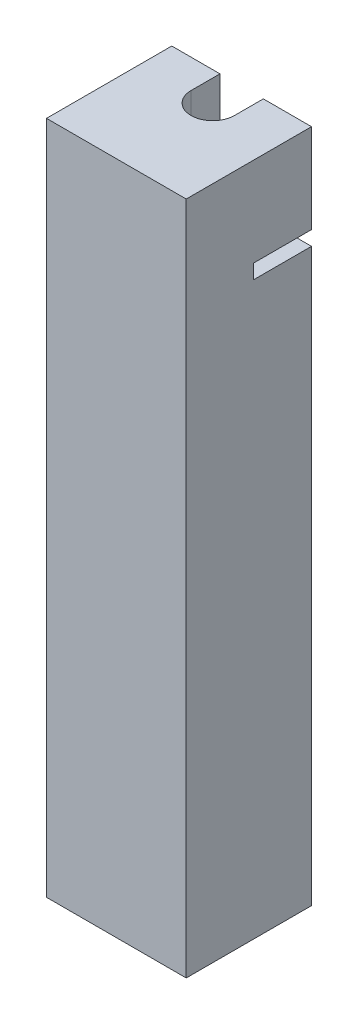
from build123d import *
from build123d.topology import SkipClean

# Parameters (mm, degrees)
BOSS_EXTRUDE1_DEPTH = 35
SKETCH2_W           = 14.5
SKETCH2_H           = 1.5
CUT_EXTRUDE1_DEPTH  = 6
BOSS_EXTRUDE2_REACH = 40.034
SKETCH2_3_W         = 14.5
SKETCH2_3_H         = 9.25
BOSS_EXTRUDE3_START = 3
BOSS_EXTRUDE3_DEPTH = 3


with BuildPart() as part:
    # Sketch1 → Boss-Extrude1 (new, symmetric)
    with BuildSketch(Plane(origin=(0, 0, 0), x_dir=(1, 0, 0), z_dir=(0, 1, 0))):
        with BuildLine():
            Line((-7.25, 3), (-2.25, 3))
            Line((-2.25, 3), (-2.25, 0))
            ThreePointArc((-2.25, 0), (0, -2.25), (2.25, 0))
            Line((2.25, 0), (2.25, 3))
            Line((2.25, 3), (7.25, 3))
            Line((7.25, 3), (7.25, -10))
            Line((7.25, -10), (-7.25, -10))
            Line((-7.25, -10), (-7.25, 3))
        make_face()
    extrude(amount=BOSS_EXTRUDE1_DEPTH, both=True)

    # Sketch2 → Cut-Extrude1 (cut)
    with BuildSketch(Plane(origin=(0, 0, -3), x_dir=(-1, 0, 0), z_dir=(0, 0, -1))):
        with Locations((0, 25)):
            Rectangle(SKETCH2_W, SKETCH2_H)
    extrude(amount=-CUT_EXTRUDE1_DEPTH, mode=Mode.SUBTRACT)

    # Sketch2<3> → Boss-Extrude2 (add, up to next)
    with BuildSketch(Plane(origin=(0, 0, -3), x_dir=(-1, 0, 0), z_dir=(0, 0, -1)), mode=Mode.PRIVATE) as boss_extrude2_sk1:
        with Locations((0, -30.375)):
            Rectangle(SKETCH2_3_W, SKETCH2_3_H)
    boss_extrude2_tool1 = extrude(boss_extrude2_sk1.sketch, amount=-BOSS_EXTRUDE2_REACH, mode=Mode.PRIVATE) - part.part
    add(boss_extrude2_tool1.solids().sort_by_distance((0, -30.375, -3))[0])

    # Sketch3 → Boss-Extrude3 (add)
    with SkipClean():  # the faces are left unmerged after this step: merging them gives an invalid solid
        with BuildSketch(Plane(origin=(0, -25.75, 0), x_dir=(1, 0, 0), z_dir=(0, 1, 0)).offset(BOSS_EXTRUDE3_START)):
            with BuildLine():
                Line((2.25, 0), (2.25, 3))
                Line((2.25, 3), (-2.25, 3))
                Line((-2.25, 3), (-2.25, 0))
                ThreePointArc((-2.25, 0), (0, 2.25), (2.25, 0))
            make_face()
        extrude(amount=-BOSS_EXTRUDE3_DEPTH)


solid = part.part
